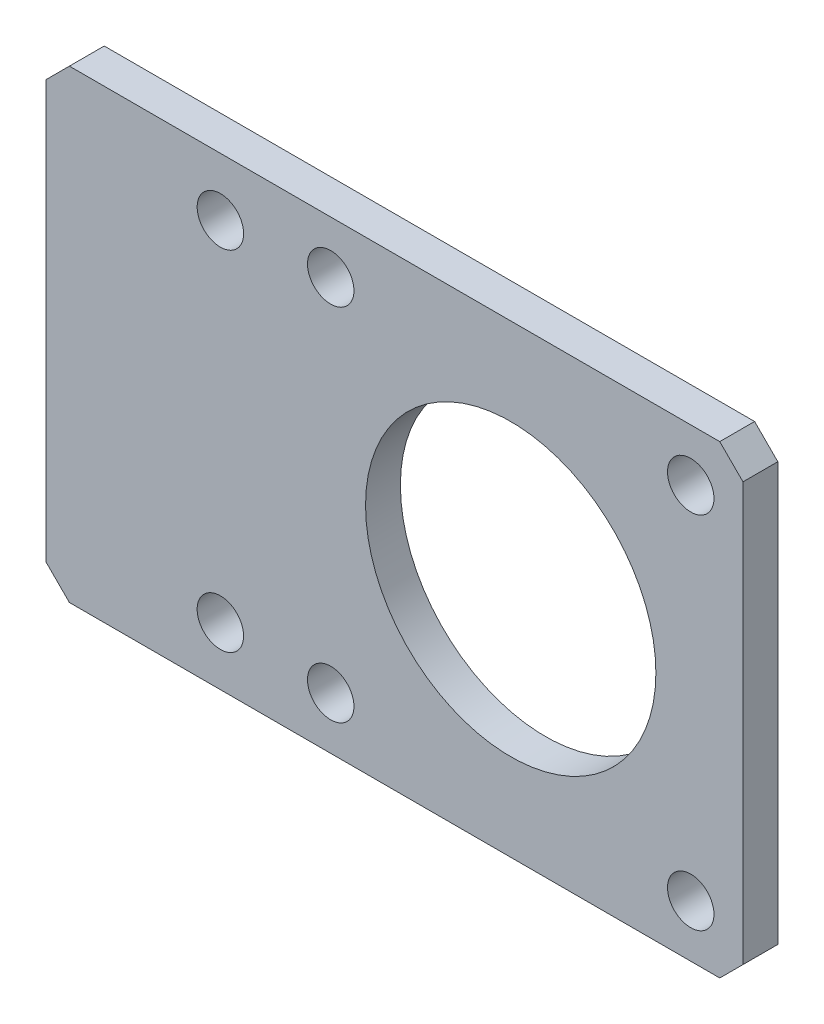
from build123d import *

# Parameters (mm, degrees)
SKETCH1_W           = 60
SKETCH1_H           = 40
BOSS_EXTRUDE1_DEPTH = 3
SKETCH2_R           = 2
SKETCH2_R_2         = 12.5
CUT_EXTRUDE1_DEPTH  = 73.173402303
CHAMFER1_SIZE       = 2


with BuildPart() as part:
    # Sketch1 → Boss-Extrude1 (new body)
    with BuildSketch(Plane.XY):
        with Locations((30, 20)):
            Rectangle(SKETCH1_W, SKETCH1_H)
    extrude(amount=BOSS_EXTRUDE1_DEPTH)

    # Sketch2 → Cut-Extrude1 (cut, through all)
    with BuildSketch(Plane.XY.offset(3)):
        with Locations((24.5, 35.5)):
            Circle(SKETCH2_R)
        with Locations((55.5, 35.5)):
            Circle(SKETCH2_R)
        with Locations((55.5, 4.5)):
            Circle(SKETCH2_R)
        with Locations((24.5, 4.5)):
            Circle(SKETCH2_R)
        with Locations((40, 20)):
            Circle(SKETCH2_R_2)
        with Locations((15, 35)):
            Circle(SKETCH2_R)
        with Locations((15, 5)):
            Circle(SKETCH2_R)
    extrude(amount=-CUT_EXTRUDE1_DEPTH, mode=Mode.SUBTRACT)

    # Chamfer1
    chamfer1_edges = [part.edges().sort_by_distance(p)[0] for p in [
        (0, 0, 1.5),
        (60, 0, 1.5),
        (60, 40, 1.5),
        (0, 40, 1.5),
    ]]
    chamfer(chamfer1_edges, length=CHAMFER1_SIZE)


solid = part.part
